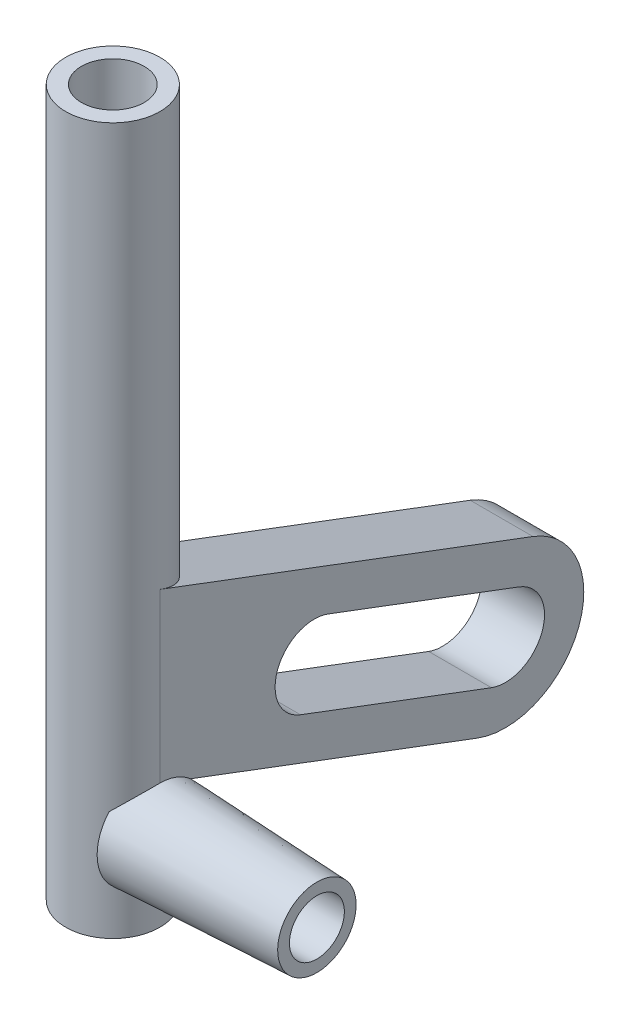
from build123d import *

# Parameters (mm, degrees)
SKETCH_1_W          = 1
SKETCH_1_H          = 45
EXTRUDE_START       = -2
SKETCH_2_R          = 3
EXTRUDE_1_DEPTH     = 2
CUT_EXTRUDE_START   = -13
SKETCH_4_R          = 1.75
CUT_EXTRUDE_1_DEPTH = 13
EXTRUDE_2_DEPTH     = 4
CUT_EXTRUDE_START_2 = -43
SKETCH_6_R          = 2
CUT_EXTRUDE_2_DEPTH = 43


with BuildPart() as part:
    # Эскиз1 → Повернуть1 (revolve)
    with BuildSketch(Plane.XY):
        with Locations((-2.5, 22.5)):
            Rectangle(SKETCH_1_W, SKETCH_1_H)
    revolve(axis=Axis((0, 0, 0), (0, 1, 0)))

    # Эскиз2 → Бобышка-Вытянуть1 (add)
    with BuildSketch(Plane(origin=(0, 0, 0), x_dir=(-1, 0, 0), z_dir=(0, -1, 0)).offset(EXTRUDE_START)):
        Circle(SKETCH_2_R)
    extrude(amount=EXTRUDE_1_DEPTH)

    # Эскиз3 → Повернуть2 (revolve)
    with BuildSketch(Plane.XY):
        Polygon((2, 2), (13, 2.5), (13, 3.25), (2, 3.25), align=None)
    revolve(axis=Axis((-0.42122471, 5, 0), (1, 0, 0)))

    # Эскиз4 → Вырез-Вытянуть1 (cut)
    with BuildSketch(Plane(origin=(13, 0, 0), x_dir=(0, 0, -1), z_dir=(1, 0, 0)).offset(CUT_EXTRUDE_START)):
        with Locations((0, 5)):
            Circle(SKETCH_4_R)
    extrude(amount=CUT_EXTRUDE_1_DEPTH, mode=Mode.SUBTRACT)

    # Эскиз5 → Бобышка-Вытянуть2 (add)
    with BuildSketch(Plane(origin=(3, 0, 0), x_dir=(0, 0, -1), z_dir=(1, 0, 0))):
        with BuildLine():
            Line((0, 18.64229817), (23.764641266, 9.678251939))
            ThreePointArc((23.764641266, 9.678251939), (26.678251939, 3.235358734), (20.235358734, 0.321748061))
            Line((20.235358734, 0.321748061), (0, 7.954545425))
            Line((0, 7.954545425), (0, 18.64229817))
        make_face()
        with BuildLine():
            Line((10.718865593, 11.927193262), (22.882320633, 7.339125969))
            ThreePointArc((22.882320633, 7.339125969), (24.339125969, 4.117679367), (21.117679367, 2.660874031))
            Line((21.117679367, 2.660874031), (8.954224326, 7.248941323))
            ThreePointArc((8.954224326, 7.248941323), (7.49741899, 10.470387926), (10.718865593, 11.927193262))
        make_face(mode=Mode.SUBTRACT)
    extrude(amount=-EXTRUDE_2_DEPTH)

    # Эскиз6 → Вырез-Вытянуть2 (cut)
    with BuildSketch(Plane(origin=(0, 45, 0), x_dir=(1, 0, 0), z_dir=(0, 1, 0)).offset(CUT_EXTRUDE_START_2)):
        Circle(SKETCH_6_R)
    extrude(amount=CUT_EXTRUDE_2_DEPTH, mode=Mode.SUBTRACT)


solid = part.part
